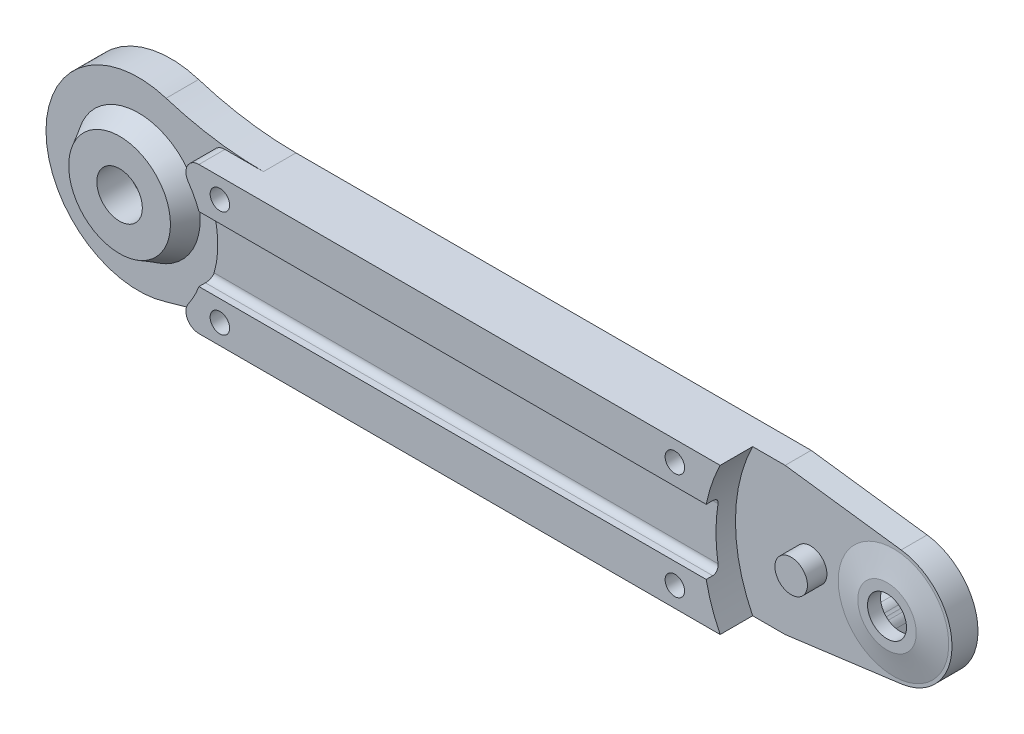
from build123d import *

# Parameters (mm, degrees)
BOSS_EXTRUDE1_DEPTH = 4
SKETCH2_R           = 2.5
BOSS_EXTRUDE2_DEPTH = 3
SKETCH3_R           = 8.5
SKETCH4_R           = 4.5
SKETCH7_R           = 3
CUT_EXTRUDE1_DEPTH  = 10
SKETCH8_W           = 90
SKETCH8_H           = 22.544950424
BOSS_EXTRUDE3_DEPTH = 4
BOSS_EXTRUDE4_DEPTH = 5
CUT_EXTRUDE2_DEPTH  = 2
CUT_EXTRUDE3_DEPTH  = 2
FILLET1_R           = 1
SKETCH13_W          = 13
SKETCH13_H          = 12
CUT_EXTRUDE4_DEPTH  = 2
BOSS_EXTRUDE5_REACH = 109.642
SKETCH14_R          = 14.22
CUT_EXTRUDE5_START  = -4
SKETCH15_R          = 14.22
CUT_EXTRUDE5_DEPTH  = 4
FILLET2_R           = 50
FILLET3_R           = 2
SKETCH16_R          = 9.5
BOSS_EXTRUDE6_DEPTH = 2.9
BOSS_EXTRUDE6_TAPER = 30
SKETCH17_R          = 3.5
CUT_EXTRUDE6_DEPTH  = 131.409814092
SKETCH18_R          = 1.5
CUT_EXTRUDE7_DEPTH  = 131.481069935
CUT_EXTRUDE8_DEPTH  = 3
CUT_EXTRUDE9_DEPTH  = 3


with BuildPart() as part:
    # Sketch1 → Boss-Extrude1 (new body)
    with BuildSketch(Plane.XY):
        with BuildLine():
            Line((1.17473573, 8.923003752), (-16.671271775, 11.272475212))
            ThreePointArc((-16.671271775, 11.272475212), (-19.953165144, 0), (-16.671271775, -11.272475212))
            Line((-16.671271775, -11.272475212), (1.17473573, -8.923003752))
            ThreePointArc((1.17473573, -8.923003752), (9, 0), (1.17473573, 8.923003752))
        make_face()
    extrude(amount=BOSS_EXTRUDE1_DEPTH)

    # Sketch2 → Boss-Extrude2 (add)
    with BuildSketch(Plane.XY.offset(4)):
        with Locations((-12.745147193, 0)):
            Circle(SKETCH2_R)
    extrude(amount=BOSS_EXTRUDE2_DEPTH)

    # Sketch3 → Cut-Loft4 section 0
    with BuildSketch(Plane.XY.offset(4)):
        Circle(SKETCH3_R)
    # Sketch4 → Cut-Loft4 section 1
    with BuildSketch(Plane.XY.offset(5)):
        Circle(SKETCH4_R)
    loft(mode=Mode.SUBTRACT)

    # Loft1: read off the stored shape, not the designer's step
    # Loft1: loft between two sections, ruled curve by curve
    loft1_from = [
        Edge.make_bspline([(-4.23778112, 1.513674727, 5), (-1.210431665, 9.989236967, 5), (7.265130574, 6.961887512, 5), (4.23778112, -1.513674727, 5), (1.210431665, -9.989236967, 5), (-7.265130574, -6.961887512, 5), (-4.23778112, 1.513674727, 5)], [0, 0, 0, 0, 0.5, 0.5, 0.5, 1, 1, 1, 1], 3, [1, 0.333333333, 0.333333333, 1, 0.333333333, 0.333333333, 1]),
    ]
    loft1_to = [
        Edge.make_bspline([(-6.95734216, 4.88317418, 4), (2.809006199, 18.7978585, 4), (16.723690519, 9.031510141, 4), (6.95734216, -4.88317418, 4), (-2.809006199, -18.7978585, 4), (-16.723690519, -9.031510141, 4), (-6.95734216, 4.88317418, 4)], [0, 0, 0, 0, 0.5, 0.5, 0.5, 1, 1, 1, 1], 3, [1, 0.333333333, 0.333333333, 1, 0.333333333, 0.333333333, 1]),
    ]
    loft1 = Solid(Shell([*[Face.make_surface_from_curves(loft1_from[k], loft1_to[k]) for k in range(1)], Face(Wire(loft1_from)), Face(Wire(loft1_to))]))
    add(loft1)

    # Sketch7 → Cut-Extrude1 (cut)
    with BuildSketch(Plane.XY.offset(5)):
        Circle(SKETCH7_R)
    extrude(amount=-CUT_EXTRUDE1_DEPTH, mode=Mode.SUBTRACT)

    # Sketch8 → Boss-Extrude3 (add)
    with BuildSketch(Plane.XY.offset(4)):
        with Locations((-61.671271775, 0)):
            Rectangle(SKETCH8_W, SKETCH8_H)
    extrude(amount=-BOSS_EXTRUDE3_DEPTH)

    # Sketch9 → Boss-Extrude4 (add)
    with BuildSketch(Plane.XY.offset(4)):
        with BuildLine():
            Line((-106.671271775, 11.272475212), (-21.671271775, 11.272475212))
            ThreePointArc((-21.671271775, 11.272475212), (-24.316626975, 0), (-21.671271775, -11.272475212))
            Line((-21.671271775, -11.272475212), (-106.671271775, -11.272475212))
            Line((-106.671271775, -11.272475212), (-106.671271775, 11.272475212))
        make_face()
    extrude(amount=BOSS_EXTRUDE4_DEPTH)

    # Sketch10 → Cut-Extrude2 (cut)
    with BuildSketch(Plane(origin=(0, 0, 0), x_dir=(-1, 0, 0), z_dir=(0, 0, -1))):
        with BuildLine():
            Line((23.091271775, 5), (8.091271775, 3.025212536))
            ThreePointArc((8.091271775, 3.025212536), (8.583093751, 0), (8.091271775, -3.025212536))
            Line((8.091271775, -3.025212536), (23.091271775, -5))
            Line((23.091271775, -5), (106.671271775, -5))
            Line((106.671271775, -5), (106.671271775, 5))
            Line((106.671271775, 5), (23.091271775, 5))
        make_face()
    extrude(amount=-CUT_EXTRUDE2_DEPTH, mode=Mode.SUBTRACT)

    # Sketch12 → Cut-Extrude3 (cut)
    with BuildSketch(Plane.XY.offset(9)):
        with BuildLine():
            Line((-106.671271775, 5), (-23.785005994, 5))
            ThreePointArc((-23.785005994, 5), (-24.316626975, 0), (-23.785005994, -5))
            Line((-23.785005994, -5), (-106.671271775, -5))
            Line((-106.671271775, -5), (-106.671271775, 5))
        make_face()
    extrude(amount=-CUT_EXTRUDE3_DEPTH, mode=Mode.SUBTRACT)

    # Fillet1
    fillet1_edges = [part.edges().sort_by_distance(p)[0] for p in [
        (-65.244855139, 5, 7),
        (-65.244855139, -5, 7),
    ]]
    fillet(fillet1_edges, radius=FILLET1_R)

    # Sketch13 → Cut-Extrude4 (cut)
    with BuildSketch(Plane(origin=(0, 0, 0), x_dir=(-1, 0, 0), z_dir=(0, 0, -1))):
        with Locations((100.171271775, 0)):
            Rectangle(SKETCH13_W, SKETCH13_H)
    extrude(amount=-CUT_EXTRUDE4_DEPTH, mode=Mode.SUBTRACT)

    # Boss-Extrude5: up to this face of the body (flat: up to its plane)
    boss_extrude5_end = Plane(part.part.faces().sort_by_distance((-64.78254731, 8.149583263, 9))[0])
    # Sketch14 → Boss-Extrude5 (add, up to the picked face)
    with BuildSketch(Plane(origin=(0, 0, 0), x_dir=(-1, 0, 0), z_dir=(0, 0, -1)), mode=Mode.PRIVATE) as boss_extrude5_sk1:
        with Locations((115.171271775, 0)):
            Circle(SKETCH14_R)
    boss_extrude5_tool1 = split(extrude(boss_extrude5_sk1.sketch, amount=-BOSS_EXTRUDE5_REACH, mode=Mode.PRIVATE), bisect_by=boss_extrude5_end, keep=Keep.BOTH, mode=Mode.PRIVATE)
    add(boss_extrude5_tool1.solids().sort_by(Axis((-115.171272, 0, 0), (0, 0, 1)))[0])

    # Sketch15 → Cut-Extrude5 (cut)
    with BuildSketch(Plane.XY.offset(9).offset(CUT_EXTRUDE5_START)):
        with Locations((-115.171271775, 0)):
            Circle(SKETCH15_R)
    extrude(amount=CUT_EXTRUDE5_DEPTH, mode=Mode.SUBTRACT)

    # Fillet2
    fillet2_edges = [part.edges().sort_by_distance(p)[0] for p in [
        (-106.502955757, -11.272475212, 2.5),
        (-106.502955757, 11.272475212, 2.5),
    ]]
    fillet(fillet2_edges, radius=FILLET2_R)

    # Fillet3
    fillet3_edges = [part.edges().sort_by_distance(p)[0] for p in [
        (-106.502955757, 11.272475212, 7),
        (-106.502955757, -11.272475212, 7),
    ]]
    fillet(fillet3_edges, radius=FILLET3_R)

    # Sketch16 → Boss-Extrude6 (add)
    with BuildSketch(Plane.XY.offset(5)):
        with Locations((-115.171271775, 0)):
            Circle(SKETCH16_R)
    extrude(amount=BOSS_EXTRUDE6_DEPTH, taper=BOSS_EXTRUDE6_TAPER)

    # Sketch17 → Cut-Extrude6 (cut, through all)
    with BuildSketch(Plane.XY.offset(7.9)):
        with Locations((-115.171271775, 0)):
            Circle(SKETCH17_R)
    extrude(amount=-CUT_EXTRUDE6_DEPTH, mode=Mode.SUBTRACT)

    # Sketch18 → Cut-Extrude7 (cut, through all)
    with BuildSketch(Plane.XY.offset(9)):
        with Locations((-98.64, 8.2)):
            Circle(SKETCH18_R)
        with Locations((-98.64, -8.2)):
            Circle(SKETCH18_R)
        with Locations((-28.64, 8.2)):
            Circle(SKETCH18_R)
        with Locations((-28.64, -8.2)):
            Circle(SKETCH18_R)
    extrude(amount=-CUT_EXTRUDE7_DEPTH, mode=Mode.SUBTRACT)

    # Sketch19 → Cut-Extrude8 (cut)
    with BuildSketch(Plane(origin=(0, 0, 0), x_dir=(-1, 0, 0), z_dir=(0, 0, -1))):
        with BuildLine():
            Line((116.637674022, -7.68), (117.027674022, -4.48))
            ThreePointArc((117.027674022, -4.48), (117.27537444, -3.695843139), (117.817674022, -3.07764524))
            Line((117.817674022, -3.07764524), (118.064134269, -2.916460247))
            Line((118.064134269, -2.916460247), (118.225319263, -2.67))
            ThreePointArc((118.225319263, -2.67), (118.843517162, -2.127700418), (119.627674022, -1.88))
            Line((119.627674022, -1.88), (122.827674022, -1.49))
            ThreePointArc((122.827674022, -1.49), (123.77044966, -0.995512646), (124.147674022, 0))
            ThreePointArc((124.147674022, 0), (123.77044966, 0.995512646), (122.827674022, 1.49))
            Line((122.827674022, 1.49), (119.627674022, 1.88))
            ThreePointArc((119.627674022, 1.88), (118.843517162, 2.127700418), (118.225319263, 2.67))
            Line((118.225319263, 2.67), (118.064134269, 2.916460247))
            Line((118.064134269, 2.916460247), (117.817674022, 3.07764524))
            ThreePointArc((117.817674022, 3.07764524), (117.27537444, 3.695843139), (117.027674022, 4.48))
            Line((117.027674022, 4.48), (116.637674022, 7.68))
            ThreePointArc((116.637674022, 7.68), (116.143186668, 8.622775638), (115.147674022, 9))
            ThreePointArc((115.147674022, 9), (114.152161377, 8.622775638), (113.657674022, 7.68))
            Line((113.657674022, 7.68), (113.267674022, 4.48))
            ThreePointArc((113.267674022, 4.48), (113.019973605, 3.695843139), (112.477674022, 3.07764524))
            Line((112.477674022, 3.07764524), (112.231213776, 2.916460247))
            Line((112.231213776, 2.916460247), (112.070028782, 2.67))
            ThreePointArc((112.070028782, 2.67), (111.451830883, 2.127700418), (110.667674022, 1.88))
            Line((110.667674022, 1.88), (107.467674022, 1.49))
            ThreePointArc((107.467674022, 1.49), (106.524898385, 0.995512646), (106.147674022, 0))
            ThreePointArc((106.147674022, 0), (106.524898385, -0.995512646), (107.467674022, -1.49))
            Line((107.467674022, -1.49), (110.667674022, -1.88))
            ThreePointArc((110.667674022, -1.88), (111.451830883, -2.127700418), (112.070028782, -2.67))
            Line((112.070028782, -2.67), (112.231213776, -2.916460247))
            Line((112.231213776, -2.916460247), (112.477674022, -3.07764524))
            ThreePointArc((112.477674022, -3.07764524), (113.019973605, -3.695843139), (113.267674022, -4.48))
            Line((113.267674022, -4.48), (113.657674022, -7.68))
            ThreePointArc((113.657674022, -7.68), (114.152161377, -8.622775638), (115.147674022, -9))
            ThreePointArc((115.147674022, -9), (116.143186668, -8.622775638), (116.637674022, -7.68))
        make_face()
    extrude(amount=-CUT_EXTRUDE8_DEPTH, mode=Mode.SUBTRACT)

    # Sketch20 → Cut-Extrude9 (cut)
    with BuildSketch(Plane(origin=(0, 0, 0), x_dir=(-1, 0, 0), z_dir=(0, 0, -1))):
        with BuildLine():
            Line((1.2, -6.33), (1.8, -4.1378116))
            ThreePointArc((1.8, -4.1378116), (2.058560194, -3.569045514), (2.48, -3.1078116))
            ThreePointArc((2.48, -3.1078116), (2.641475661, -2.955390865), (2.794244497, -2.794244497))
            ThreePointArc((2.794244497, -2.794244497), (2.955390865, -2.641475661), (3.1078116, -2.48))
            ThreePointArc((3.1078116, -2.48), (3.569045514, -2.058560194), (4.1378116, -1.8))
            Line((4.1378116, -1.8), (6.33, -1.2))
            ThreePointArc((6.33, -1.2), (6.992020752, -0.754882576), (7.25, 0))
            ThreePointArc((7.25, 0), (6.992020752, 0.754882576), (6.33, 1.2))
            Line((6.33, 1.2), (4.1378116, 1.8))
            ThreePointArc((4.1378116, 1.8), (3.569045514, 2.058560194), (3.1078116, 2.48))
            ThreePointArc((3.1078116, 2.48), (2.955390865, 2.641475661), (2.794244497, 2.794244497))
            ThreePointArc((2.794244497, 2.794244497), (2.641475661, 2.955390865), (2.48, 3.1078116))
            ThreePointArc((2.48, 3.1078116), (2.058560194, 3.569045514), (1.8, 4.1378116))
            Line((1.8, 4.1378116), (1.2, 6.33))
            ThreePointArc((1.2, 6.33), (0.754882576, 6.992020752), (0, 7.25))
            ThreePointArc((0, 7.25), (-0.754882576, 6.992020752), (-1.2, 6.33))
            Line((-1.2, 6.33), (-1.8, 4.1378116))
            ThreePointArc((-1.8, 4.1378116), (-2.058560194, 3.569045514), (-2.48, 3.1078116))
            ThreePointArc((-2.48, 3.1078116), (-2.641475661, 2.955390865), (-2.794244497, 2.794244497))
            ThreePointArc((-2.794244497, 2.794244497), (-2.955390865, 2.641475661), (-3.1078116, 2.48))
            ThreePointArc((-3.1078116, 2.48), (-3.569045514, 2.058560194), (-4.1378116, 1.8))
            Line((-4.1378116, 1.8), (-6.33, 1.2))
            ThreePointArc((-6.33, 1.2), (-6.992020752, 0.754882576), (-7.25, 0))
            ThreePointArc((-7.25, 0), (-6.992020752, -0.754882576), (-6.33, -1.2))
            Line((-6.33, -1.2), (-4.1378116, -1.8))
            ThreePointArc((-4.1378116, -1.8), (-3.569045514, -2.058560194), (-3.1078116, -2.48))
            ThreePointArc((-3.1078116, -2.48), (-2.955390865, -2.641475661), (-2.794244497, -2.794244497))
            ThreePointArc((-2.794244497, -2.794244497), (-2.641475661, -2.955390865), (-2.48, -3.1078116))
            ThreePointArc((-2.48, -3.1078116), (-2.058560194, -3.569045514), (-1.8, -4.1378116))
            Line((-1.8, -4.1378116), (-1.2, -6.33))
            ThreePointArc((-1.2, -6.33), (-0.754882576, -6.992020752), (0, -7.25))
            ThreePointArc((0, -7.25), (0.754882576, -6.992020752), (1.2, -6.33))
        make_face()
    extrude(amount=-CUT_EXTRUDE9_DEPTH, mode=Mode.SUBTRACT)


solid = part.part
